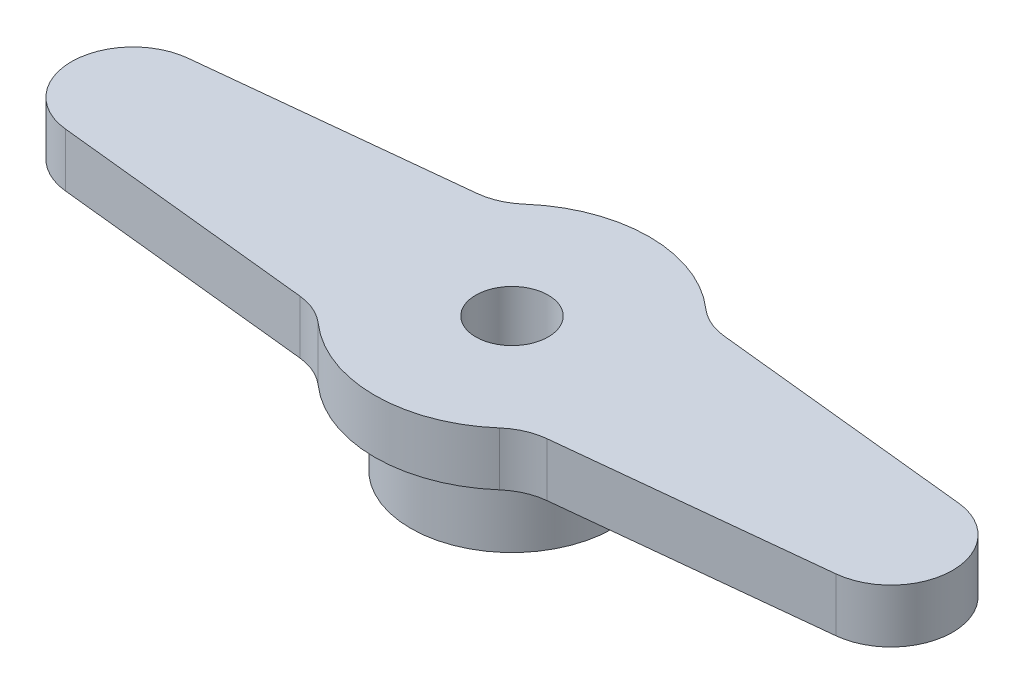
from build123d import *

# Parameters (mm, degrees)
SKETCH1_R           = 4.3688
SKETCH1_R_2         = 3.048
BOSS_EXTRUDE1_DEPTH = 3.429
BOSS_EXTRUDE2_DEPTH = 2.3114
SKETCH3_R           = 1.5621
CUT_EXTRUDE1_DEPTH  = 21.699383219


with BuildPart() as part:
    # Sketch1 → Boss-Extrude1 (new body)
    with BuildSketch(Plane(origin=(0, 0, 0), x_dir=(1, 0, 0), z_dir=(0, 1, 0))):
        Circle(SKETCH1_R)
        Circle(SKETCH1_R_2, mode=Mode.SUBTRACT)
    extrude(amount=BOSS_EXTRUDE1_DEPTH)

    # Sketch2 → Boss-Extrude2 (add)
    with BuildSketch(Plane(origin=(0, 3.429, 0), x_dir=(1, 0, 0), z_dir=(0, 1, 0))):
        with BuildLine():
            Line((5.322708788, 3.823825598), (16.607191493, 2.6416))
            ThreePointArc((16.607191493, 2.6416), (18.9865, 0), (16.607191493, -2.6416))
            Line((16.607191493, -2.6416), (5.322708788, -3.823825598))
            ThreePointArc((5.322708788, -3.823825598), (4.567932808, -4.023552477), (3.909477587, -4.443093093))
            ThreePointArc((3.909477587, -4.443093093), (0, -5.9182), (-3.909477587, -4.443093093))
            ThreePointArc((-3.909477587, -4.443093093), (-4.567932808, -4.023552477), (-5.322708788, -3.823825598))
            Line((-5.322708788, -3.823825598), (-16.607191493, -2.6416))
            ThreePointArc((-16.607191493, -2.6416), (-18.9865, 0), (-16.607191493, 2.6416))
            Line((-16.607191493, 2.6416), (-5.322708788, 3.823825598))
            ThreePointArc((-5.322708788, 3.823825598), (-4.567932808, 4.023552477), (-3.909477587, 4.443093093))
            ThreePointArc((-3.909477587, 4.443093093), (0, 5.9182), (3.909477587, 4.443093093))
            ThreePointArc((3.909477587, 4.443093093), (4.567932808, 4.023552477), (5.322708788, 3.823825598))
        make_face()
    extrude(amount=BOSS_EXTRUDE2_DEPTH)

    # Sketch3 → Cut-Extrude1 (cut, through all)
    with BuildSketch(Plane(origin=(0, 5.7404, 0), x_dir=(1, 0, 0), z_dir=(0, 1, 0))):
        Circle(SKETCH3_R)
    extrude(amount=-CUT_EXTRUDE1_DEPTH, mode=Mode.SUBTRACT)


solid = part.part
